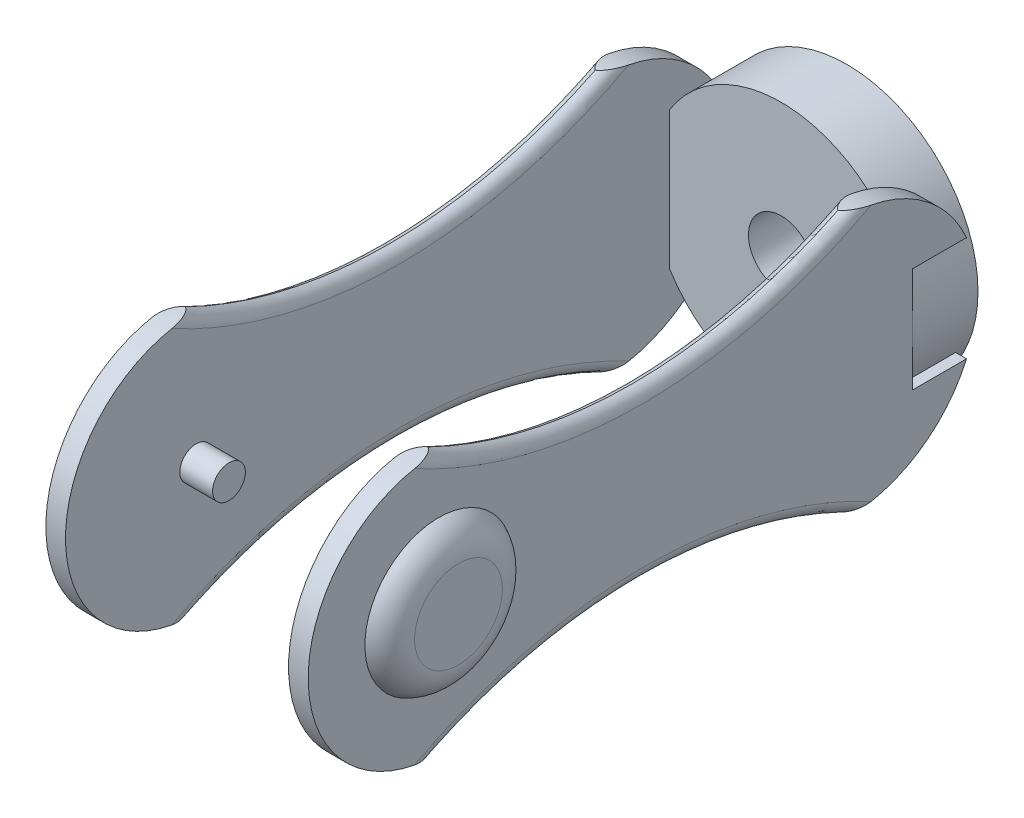
from build123d import *

# Parameters (mm, degrees)
SKETCH2_R           = 20
SKETCH2_R_2         = 5
BOSS_EXTRUDE1_DEPTH = 10
BOSS_EXTRUDE2_DEPTH = 3
CIRPATTERN1_COUNT   = 2
SKETCH5_R           = 2.5
BOSS_EXTRUDE3_DEPTH = 5
BOSS_EXTRUDE4_START = 5
SKETCH6_R           = 2.5
BOSS_EXTRUDE4_DEPTH = 5
CUT_EXTRUDE1_DEPTH  = 147
FILLET1_R           = 2
SKETCH8_R           = 11.27429685
BOSS_EXTRUDE5_DEPTH = 3
FILLET2_R           = 5
SKETCH9_R           = 11.275
BOSS_EXTRUDE6_DEPTH = 3
FILLET3_R           = 5


with BuildPart() as part:
    # Sketch2 → Boss-Extrude1 (new body)
    with BuildSketch(Plane.XY):
        Circle(SKETCH2_R)
        Circle(SKETCH2_R_2, mode=Mode.SUBTRACT)
    extrude(amount=BOSS_EXTRUDE1_DEPTH)

    # Sketch4 → Boss-Extrude2 (add)
    with BuildSketch(Plane(origin=(20, 0, 0), x_dir=(0, 0, -1), z_dir=(1, 0, 0))):
        with BuildLine():
            Line((-82.207951234, 19.918138143), (-19.990870076, 19.918138143))
            ThreePointArc((-19.990870076, 19.918138143), (-9.096212625, 16.67449148), (-1.749920893, 8))
            Line((-1.749920893, 8), (-10, 8))
            Line((-10, 8), (-10, -8))
            Line((-10, -8), (-1.749920893, -8))
            ThreePointArc((-1.749920893, -8), (-9.096212625, -16.67449148), (-19.990870076, -19.918138143))
            Line((-19.990870076, -19.918138143), (-82.207951234, -19.918138143))
            ThreePointArc((-82.207951234, -19.918138143), (-102.126089377, 0), (-82.207951234, 19.918138143))
        make_face()
    boss_extrude2 = extrude(amount=-BOSS_EXTRUDE2_DEPTH)

    # CirPattern1: Boss-Extrude2 ×2 about axis
    cirpattern1_axis = Axis((0, 0, 0), (0, 0, 1))
    for i in range(1, CIRPATTERN1_COUNT):
        add(boss_extrude2.rotate(cirpattern1_axis, i * 360 / CIRPATTERN1_COUNT))

    # Sketch5 → Boss-Extrude3 (add)
    with BuildSketch(Plane(origin=(-17, 0, 0), x_dir=(0, 0, -1), z_dir=(1, 0, 0))):
        with Locations(Location((-82.207951234, 0, 0), (0, 0, 180))):
            Circle(SKETCH5_R)
    extrude(amount=BOSS_EXTRUDE3_DEPTH)

    # Sketch6 → Boss-Extrude4 (add)
    with BuildSketch(Plane.ZY.offset(-17).offset(BOSS_EXTRUDE4_START)):
        with Locations((82.207951234, 0)):
            Circle(SKETCH6_R)
    extrude(amount=-BOSS_EXTRUDE4_DEPTH)

    # Sketch7 → Cut-Extrude1 (cut)
    with BuildSketch(Plane(origin=(20, 0, 0), x_dir=(0, 0, -1), z_dir=(1, 0, 0))):
        with BuildLine():
            Line((-82.207951234, 19.918138143), (-19.990870076, 19.918138143))
            ThreePointArc((-19.990870076, 19.918138143), (-51.099410655, 12.742712192), (-82.207951234, 19.918138143))
        make_face()
        with BuildLine():
            Line((-82.207951234, -19.918138143), (-19.990870076, -19.918138143))
            ThreePointArc((-19.990870076, -19.918138143), (-51.099410655, -12.873612926), (-82.207951234, -19.918138143))
        make_face()
    extrude(amount=-CUT_EXTRUDE1_DEPTH, mode=Mode.SUBTRACT)

    # Fillet1
    # the kernel refuses this fillet: 2 mm, written as the material it takes off along each edge
    with BuildSketch(Plane(origin=(-20, -85.083350362, 51.099410655), x_dir=(0, 0.8704701074712403, -0.49222128356970424), z_dir=(0, -0.49222128356970424, -0.8704701074712403))) as fillet1_piece_1:
        with BuildLine():
            CenterArc((72.209737436 + FILLET1_R, FILLET1_R), FILLET1_R, 180, 90)
            Line((72.209737436 + FILLET1_R, 0), (72.209737436, 0))
            Line((72.209737436, 0), (72.209737436, FILLET1_R))
        make_face()
    revolve(axis=Axis((-20, -85.083350362, 51.099410655), (1, 0, 0)), revolution_arc=58.973369899, mode=Mode.SUBTRACT)
    with BuildSketch(Plane(origin=(-17, -85.083350362, 51.099410655), x_dir=(0, 0.8704701074712403, -0.49222128356970424), z_dir=(0, -0.49222128356970424, -0.8704701074712403))) as fillet1_piece_2:
        with BuildLine():
            CenterArc((72.209737436 + FILLET1_R, -FILLET1_R), FILLET1_R, 90, 90)
            Line((72.209737436, -FILLET1_R), (72.209737436, 0))
            Line((72.209737436, 0), (72.209737436 + FILLET1_R, 0))
        make_face()
    revolve(axis=Axis((-17, -85.083350362, 51.099410655), (1, 0, 0)), revolution_arc=58.973369899, mode=Mode.SUBTRACT)
    with BuildSketch(Plane(origin=(-17, 83.764839764, 51.099410655), x_dir=(0, -0.8659267657003706, 0.5001708072685723), z_dir=(0, 0.5001708072685723, 0.8659267657003706))) as fillet1_piece_3:
        with BuildLine():
            CenterArc((71.022127572 + FILLET1_R, -FILLET1_R), FILLET1_R, 90, 90)
            Line((71.022127572, -FILLET1_R), (71.022127572, 0))
            Line((71.022127572, 0), (71.022127572 + FILLET1_R, 0))
        make_face()
    revolve(axis=Axis((-17, 83.764839764, 51.099410655), (1, 0, 0)), revolution_arc=60.022602323, mode=Mode.SUBTRACT)
    with BuildSketch(Plane(origin=(-20, 83.764839764, 51.099410655), x_dir=(0, -0.8659267657003706, 0.5001708072685723), z_dir=(0, 0.5001708072685723, 0.8659267657003706))) as fillet1_piece_4:
        with BuildLine():
            CenterArc((71.022127572 + FILLET1_R, FILLET1_R), FILLET1_R, 180, 90)
            Line((71.022127572 + FILLET1_R, 0), (71.022127572, 0))
            Line((71.022127572, 0), (71.022127572, FILLET1_R))
        make_face()
    revolve(axis=Axis((-20, 83.764839764, 51.099410655), (1, 0, 0)), revolution_arc=60.022602323, mode=Mode.SUBTRACT)
    with BuildSketch(Plane(origin=(17, 83.764839764, 51.099410655), x_dir=(0, -0.8659267657003706, 0.5001708072685723), z_dir=(0, 0.5001708072685723, 0.8659267657003706))) as fillet1_piece_5:
        with BuildLine():
            CenterArc((71.022127572 + FILLET1_R, FILLET1_R), FILLET1_R, 180, 90)
            Line((71.022127572, FILLET1_R), (71.022127572, 0))
            Line((71.022127572, 0), (71.022127572 + FILLET1_R, 0))
        make_face()
    revolve(axis=Axis((17, 83.764839764, 51.099410655), (1, 0, 0)), revolution_arc=60.022602323, mode=Mode.SUBTRACT)
    with BuildSketch(Plane(origin=(20, -85.083350362, 51.099410655), x_dir=(0, 0.8704701074712403, -0.49222128356970424), z_dir=(0, -0.49222128356970424, -0.8704701074712403))) as fillet1_piece_6:
        with BuildLine():
            CenterArc((72.209737436 + FILLET1_R, -FILLET1_R), FILLET1_R, 90, 90)
            Line((72.209737436, -FILLET1_R), (72.209737436, 0))
            Line((72.209737436, 0), (72.209737436 + FILLET1_R, 0))
        make_face()
    revolve(axis=Axis((20, -85.083350362, 51.099410655), (1, 0, 0)), revolution_arc=58.973369899, mode=Mode.SUBTRACT)
    with BuildSketch(Plane(origin=(20, 83.764839764, 51.099410655), x_dir=(0, -0.8659267657003705, -0.5001708072685725), z_dir=(0, 0.5001708072685725, -0.8659267657003705))) as fillet1_piece_7:
        with BuildLine():
            CenterArc((71.022127572 + FILLET1_R, FILLET1_R), FILLET1_R, 180, 90)
            Line((71.022127572, FILLET1_R), (71.022127572, 0))
            Line((71.022127572, 0), (71.022127572 + FILLET1_R, 0))
        make_face()
    revolve(axis=Axis((20, 83.764839764, 51.099410655), (-1, 0, 0)), revolution_arc=60.022602323, mode=Mode.SUBTRACT)

    # Sketch8 → Boss-Extrude5 (add)
    with BuildSketch(Plane(origin=(20, 0, 0), x_dir=(0, 0, -1), z_dir=(1, 0, 0))):
        with Locations((-82.207951234, 0)):
            Circle(SKETCH8_R)
    extrude(amount=BOSS_EXTRUDE5_DEPTH)

    # Fillet2
    # the kernel refuses this fillet: 5 mm, written as the material it takes off along each edge
    with BuildSketch(Plane(origin=(23, 0, 82.207951234), x_dir=(0, 0, -1), z_dir=(0, -1, 0))) as fillet2_piece_1:
        with BuildLine():
            CenterArc((6.691721155, -5), FILLET2_R, 23.578178478, 66.421821522)
            Line((6.691721155, 0), (6.691721155, 0.1))
            Line((6.691721155, 0.1), (11.27429685, 0.1))
            Line((11.27429685, 0.1), (11.37429685, 0))
            ThreePointArc((11.37429685, 0), (11.37429685, -1.5), (11.365948364, -2.96))
            Line((11.365948364, -2.96), (11.27429685, -3))
        make_face()
    revolve(axis=Axis((23, 0, 82.207951234), (1, 0, 0)), mode=Mode.SUBTRACT)

    # Sketch9 → Boss-Extrude6 (add)
    with BuildSketch(Plane.ZY.offset(20)):
        with Locations((82.207951234, 0)):
            Circle(SKETCH9_R)
    extrude(amount=BOSS_EXTRUDE6_DEPTH)

    # Fillet3
    # the kernel refuses this fillet: 5 mm, written as the material it takes off along each edge
    with BuildSketch(Plane(origin=(-23, 0, 82.207951234), x_dir=(0, 0, 1), z_dir=(0, -1, 0))) as fillet3_piece_1:
        with BuildLine():
            CenterArc((6.692424305, -5), FILLET3_R, 23.578178478, 66.421821522)
            Line((6.692424305, 0), (6.692424305, 0.1))
            Line((6.692424305, 0.1), (11.275, 0.1))
            Line((11.275, 0.1), (11.375, 0))
            ThreePointArc((11.375, 0), (11.375, -1.5), (11.366651514, -2.96))
            Line((11.366651514, -2.96), (11.275, -3))
        make_face()
    revolve(axis=Axis((-23, 0, 82.207951234), (-1, 0, 0)), mode=Mode.SUBTRACT)


solid = part.part
